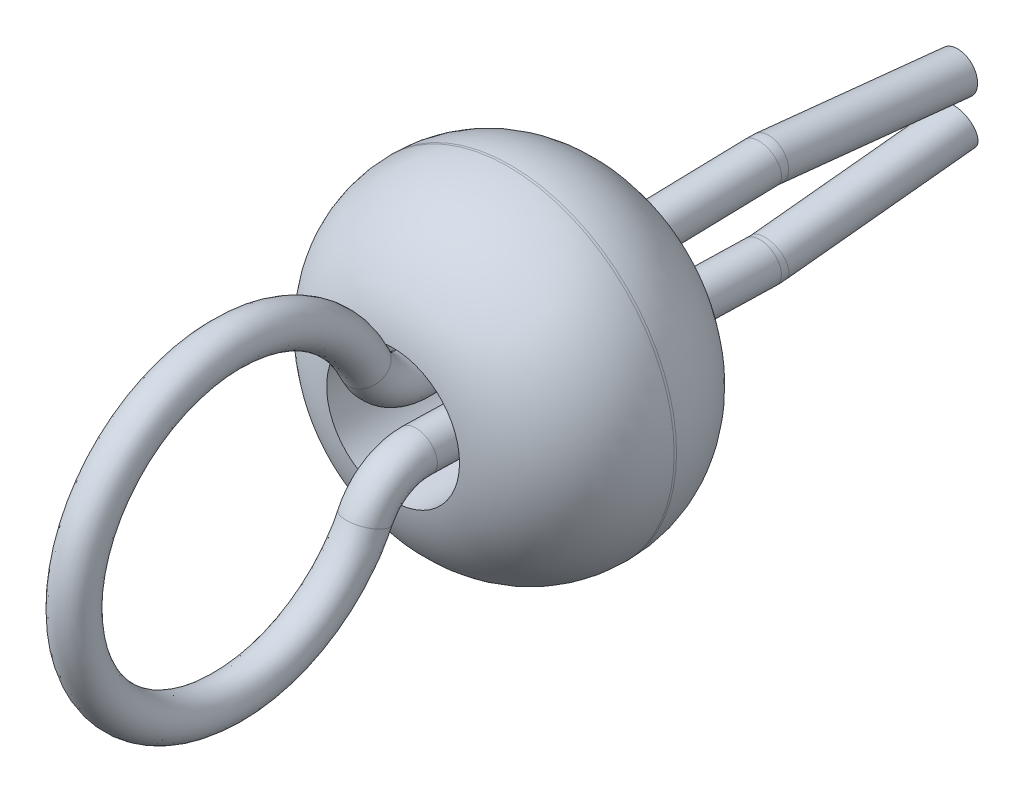
from build123d import *

# Parameters (mm, degrees)
SKETCH1_R          = 1.27
SKETCH1_R_2        = 0.508
PLASTIC_RING_DEPTH = 1.778
WIRE_PROFILE_R     = 0.1524
FILLET_6_R         = 0.889


with BuildPart() as part:
    # Sketch1 → Plastic-Ring (new body)
    with BuildSketch(Plane.XY):
        Circle(SKETCH1_R)
        Circle(SKETCH1_R_2, mode=Mode.SUBTRACT)
    extrude(amount=PLASTIC_RING_DEPTH)

    # 圆角6
    # the kernel refuses this fillet: 0.889 mm, written as the material it takes off along each edge
    with BuildSketch(Plane(origin=(0, 0, 0), x_dir=(1, 0, 0), z_dir=(0, -1, 0))) as fillet_6_piece_1:
        with BuildLine():
            CenterArc((0.381, 0.87988181), FILLET_6_R, 278.213210702, 81.786789298)
            Line((0.508, 0), (0.51054, -0.017597636))
            ThreePointArc((0.51054, -0.017597636), (0.889, -0.01778), (1.27, -0.01778))
            Line((1.27, -0.01778), (1.28778, 0))
            Line((1.28778, 0), (1.28778, 0.87988181))
            Line((1.28778, 0.87988181), (1.27, 0.87988181))
        make_face()
    revolve(axis=Axis((0, 0, 0), (0, 0, 1)), mode=Mode.SUBTRACT)
    with BuildSketch(Plane(origin=(0, 0, 1.778), x_dir=(1, 0, 0), z_dir=(0, -1, 0))) as fillet_6_piece_2:
        with BuildLine():
            CenterArc((0.381, -0.87988181), FILLET_6_R, 0, 81.786789298)
            Line((0.508, 0), (0.51054, 0.017597636))
            ThreePointArc((0.51054, 0.017597636), (0.889, 0.01778), (1.27, 0.01778))
            Line((1.27, 0.01778), (1.28778, 0))
            Line((1.28778, 0), (1.28778, -0.87988181))
            Line((1.28778, -0.87988181), (1.27, -0.87988181))
        make_face()
    revolve(axis=Axis((0, 0, 1.778), (0, 0, 1)), mode=Mode.SUBTRACT)


with BuildPart() as body_2:
    # Sweep3: sweep along a path in wire-bend
    with BuildLine(Plane(origin=(0, 0, 0), x_dir=(0, 0, -1), z_dir=(1, 0, 0))) as sweep3_path:
        Line((2.54, 0.1778), (1.094480717, 0.327336478))
        ThreePointArc((1.094480717, 0.327336478), (1.06676532, 0.329304864), (1.038980707, 0.329486685))
        Line((1.038980707, 0.329486685), (-1.592148749, 0.262021827))
        ThreePointArc((-1.592148749, 0.262021827), (-1.828459816, 0.325282242), (-1.992475214, 0.506786372))
        ThreePointArc((-1.992475214, 0.506786372), (-4.218882146, 0), (-1.992475214, -0.506786372))
        ThreePointArc((-1.992475214, -0.506786372), (-1.828459816, -0.325282242), (-1.592148749, -0.262021827))
        Line((-1.592148749, -0.262021827), (1.038980707, -0.329486685))
        ThreePointArc((1.038980707, -0.329486685), (1.06676532, -0.329304864), (1.094480717, -0.327336478))
        Line((1.094480717, -0.327336478), (2.54, -0.1778))
    # wire-profile → Sweep3 (sweep)
    with BuildSketch(Plane.XY.offset(-2.54)):
        with Locations((0, 0.1778)):
            Circle(WIRE_PROFILE_R)
    sweep(path=sweep3_path.line)


solid = Compound([part.part, body_2.part])
